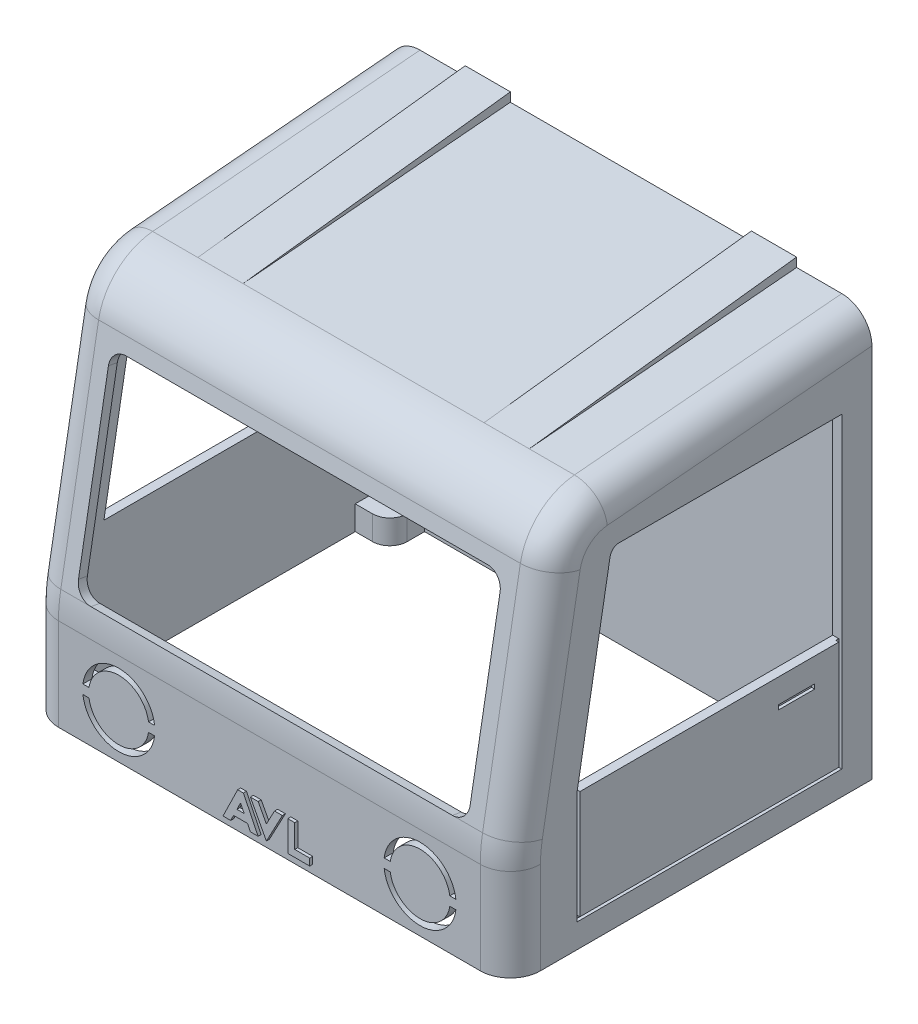
from build123d import *

# Parameters (mm, degrees)
SKETCH1_W            = 160
SKETCH1_H            = 120.00000000000001
BOSS_EXTRUDE1_DEPTH  = 95
MOVE_FACE1_OUTLINE_W = 160
MOVE_FACE1_OUTLINE_H = 99
MOVE_FACE1_DEPTH     = 17
MOVE_START           = -1
MOVE_FACE3_DEPTH     = 162
MOVE_FACE3_2_DEPTH   = 160
BOSS_EXTRUDE2_DEPTH  = 160
FILLET2_R            = 20
FILLET3_R            = 10
FILLET4_R            = 50
SHELL2_T             = -3
CUT_EXTRUDE1_DEPTH   = 10
FILLET5_R            = 5
CUT_EXTRUDE2_REACH   = 225.468
FILLET6_R            = 3
BOSS_EXTRUDE3_START  = -35
SKETCH7_R            = 5.7500000000000036
SKETCH7_R_2          = 2.7499999999999987
SKETCH7_R_3          = 2.7500000000000355
SKETCH7_R_4          = 5.750000000000003
SKETCH7_R_5          = 2.7500000000000346
SKETCH7_R_6          = 5.749999999999999
SKETCH7_R_7          = 2.7499999999999982
BOSS_EXTRUDE3_DEPTH  = 8
CUT_EXTRUDE3_START   = -35
SKETCH7_3_R          = 2.7499999999999982
SKETCH7_3_R_2        = 2.7500000000000355
SKETCH7_3_R_3        = 2.7499999999999987
SKETCH7_3_R_4        = 2.7500000000000346
CUT_EXTRUDE3_DEPTH   = 4
BOSS_EXTRUDE11_START = -35
SKETCH7_4_R          = 2.7499999999999987
SKETCH7_4_R_2        = 2.7500000000000346
SKETCH7_4_R_3        = 2.7499999999999982
SKETCH7_4_R_4        = 2.7500000000000355
BOSS_EXTRUDE11_DEPTH = 1
BOSS_EXTRUDE4_DEPTH  = 1
CUT_EXTRUDE4_DEPTH   = 11
SKETCH11_W           = 11.999999999999986
SKETCH11_H           = 1.5000000000000004
CUT_EXTRUDE5_DEPTH   = 1
CUT_EXTRUDE6_START   = 160
SKETCH11_2_W         = 11.999999999999986
SKETCH11_2_H         = 1.5000000000000004
CUT_EXTRUDE6_DEPTH   = 1
BOSS_EXTRUDE5_DEPTH  = 1
BOSS_EXTRUDE6_START  = 40
BOSS_EXTRUDE6_DEPTH  = 15
BOSS_EXTRUDE7_START  = -40
BOSS_EXTRUDE7_DEPTH  = 15


with BuildPart() as part:
    # Sketch1 → Boss-Extrude1 (new body)
    with BuildSketch(Plane(origin=(0, 0, 0), x_dir=(1, 0, 0), z_dir=(0, 1, 0))):
        with Locations((80, 60.00000000000001)):
            Rectangle(SKETCH1_W, SKETCH1_H)
    extrude(amount=BOSS_EXTRUDE1_DEPTH)

    # Move Face1: read off the stored shape, not the designer's step
    # Move Face1 outline → Move Face1 (cut)
    with BuildSketch(Plane(origin=(0, 0, 0), x_dir=(1, 0, 0), z_dir=(0, 0.173648177666931, 0.984807753012208))):
        with Locations((80, 48.5)):
            Rectangle(MOVE_FACE1_OUTLINE_W, MOVE_FACE1_OUTLINE_H)
    extrude(amount=MOVE_FACE1_DEPTH, mode=Mode.SUBTRACT)

    # Move Face3: read off the stored shape, not the designer's step
    # Move Face3 outline → Move Face3 (cut)
    with BuildSketch(Plane.YZ.offset(MOVE_START)):
        Polygon((95, -16.751063167), (90.588385135, -15.973176438), (95, -66.398165086), align=None)
    extrude(amount=MOVE_FACE3_DEPTH, mode=Mode.SUBTRACT)

    # Move Face3 2 outline → Move Face3 2 (add)
    with BuildSketch(Plane.YZ):
        Polygon((99.689552899, -120), (95, -66.398165086), (95, -120), align=None)
    extrude(amount=MOVE_FACE3_2_DEPTH)

    # Sketch3 → Boss-Extrude2 (add)
    with BuildSketch(Plane(origin=(0, 0, 0), x_dir=(0, 0, -1), z_dir=(1, 0, 0))):
        Polygon((0, 0), (120, 0), (120, -35), (4.29e-15, -35), align=None)
    extrude(amount=BOSS_EXTRUDE2_DEPTH)

    # Fillet2
    fillet2_edges = [part.edges().sort_by_distance(p)[0] for p in [
        (80, 90.588385135, -15.973176438),
    ]]
    fillet(fillet2_edges, radius=FILLET2_R)

    # Fillet3
    fillet3_edges = [part.edges().sort_by_distance(p)[0] for p in [
        (0, -17.5, -2.14e-15),
        (160, -17.5, -2.14e-15),
        (160, 95.80773855265602, -75.63065899035101),
        (160, 37.737496898914046, -6.654138887680599),
        (160, 86.74757698070837, -19.49262868331006),
        (0, 37.73749689891403, -6.654138887680596),
        (0, 86.74757698070837, -19.49262868331006),
        (-5e-17, 95.80773855265602, -75.63065899035101),
    ]]
    fillet(fillet3_edges, radius=FILLET3_R)

    # Fillet4
    # the kernel refuses this fillet: 50 mm, written as the material it takes off along each edge
    with BuildSketch(Plane(origin=(160, -4.374433176296216, -50), x_dir=(0, 0.173648177666931, 0.984807753012208), z_dir=(0, 0.984807753012208, -0.173648177666931))) as fillet4_piece_1:
        with BuildLine():
            CenterArc((40, -10), 10, 0, 90)
            Line((50, -10), (50, 0))
            Line((50, 0), (40, 0))
        make_face()
    revolve(axis=Axis((160, -4.374433176296216, -50), (1, 0, 0)), revolution_arc=10.000000000000012, mode=Mode.SUBTRACT)
    with BuildSketch(Plane(origin=(0, -4.374433176296216, -50), x_dir=(0, -1.2e-16, 1), z_dir=(0, -1, -1.2e-16))) as fillet4_piece_2:
        with BuildLine():
            CenterArc((40, -10), 10, 0, 90)
            Line((50, -10), (50, 0))
            Line((50, 0), (40, 0))
        make_face()
    revolve(axis=Axis((0, -4.374433176296216, -50), (-1, 0, 0)), revolution_arc=10.000000000000012, mode=Mode.SUBTRACT)
    with BuildSketch(Plane(origin=(0, 0, 0), x_dir=(0, -1, 0), z_dir=(1, 0, 0))) as fillet4_piece_3:
        with BuildLine():
            CenterArc((FILLET4_R * 0.0874886635259, FILLET4_R), FILLET4_R, 260, 10)
            Line((-FILLET4_R * 0.086159514141, FILLET4_R * 0.0151922469878), (0, 0))
            Line((0, 0), (FILLET4_R * 0.0874886635259, 0))
        make_face()
    extrude(amount=160, mode=Mode.SUBTRACT)

    # Shell2
    shell2_openings = [part.faces().sort_by_distance(p)[0] for p in [
        (80, -35, -60.129422216),
    ]]
    offset(amount=SHELL2_T, openings=shell2_openings, kind=Kind.INTERSECTION)

    # Sketch5 → Cut-Extrude1 (cut)
    with BuildSketch(Plane(origin=(0, 0, 0), x_dir=(1, 0, 0), z_dir=(0, 0.17364817766693072, 0.9848077530122081))):
        Polygon((15, 71.63931723425382), (145, 71.63931723425382), (145, 4.374433176296183), (15.000000000000007, 4.374433176296183), align=None)
    extrude(amount=-CUT_EXTRUDE1_DEPTH, mode=Mode.SUBTRACT)

    # Fillet5
    fillet5_edges = [part.edges().sort_by_distance(p)[0] for p in [
        (145, 4.047503440549922, -2.236823978907805),
        (15.000000000000007, 4.047503440549922, -2.236823978907805),
        (15, 70.29048276629386, -13.917248516549643),
        (145, 70.29048276629386, -13.917248516549643),
    ]]
    fillet(fillet5_edges, radius=FILLET5_R)

    # Cut-Extrude2: up to this face of the body (flat: up to its plane)
    cut_extrude2_end = Plane(part.part.faces().sort_by_distance((160, 23.574756994, -68.144280622))[0])
    # Sketch6 → Cut-Extrude2 (cut, up to the picked face)
    with BuildSketch(Plane(origin=(0, 0, 0), x_dir=(0, 0, -1), z_dir=(1, 0, 0)), mode=Mode.PRIVATE) as cut_extrude2_sk1:
        Polygon((110, 74.99999999999999), (33.533055790849794, 74.99999999999997), (22.071802044799554, 9.999999999999977), (110, 9.999999999999988), align=None)
    cut_extrude2_tool1 = split(extrude(cut_extrude2_sk1.sketch, amount=CUT_EXTRUDE2_REACH, mode=Mode.PRIVATE), bisect_by=cut_extrude2_end, keep=Keep.BOTH, mode=Mode.PRIVATE)
    add(cut_extrude2_tool1.solids().sort_by(Axis((0, 41.744725, -68.834627), (1, 0, 0)))[0], mode=Mode.SUBTRACT)

    # Fillet6
    fillet6_edges = [part.edges().sort_by_distance(p)[0] for p in [
        (1.5, 74.99999999999997, -33.533055790849794),
        (158.5, 74.99999999999997, -33.533055790849794),
    ]]
    fillet(fillet6_edges, radius=FILLET6_R)

    # Sketch7 → Boss-Extrude3 (add)
    # profile 1 of 18: a face of its own
    with BuildSketch(Plane(origin=(0, 0, 0), x_dir=(1, 0, 0), z_dir=(0, 1, 0)).offset(BOSS_EXTRUDE3_START)):
        with Locations((8.75, 111.24999999999999)):
            Circle(SKETCH7_R)
        with Locations((8.75, 111.24999999999999)):
            Circle(SKETCH7_R_2, mode=Mode.SUBTRACT)
    # profile 2 of 18: a face of its own
    with BuildSketch(Plane(origin=(0, 0, 0), x_dir=(1, 0, 0), z_dir=(0, 1, 0)).offset(BOSS_EXTRUDE3_START)):
        with BuildLine():
            Line((14.500000000000005, 117), (8.750000000000798, 117))
            ThreePointArc((8.750000000000798, 116.99999999999999), (12.815863991822933, 115.31586399182235), (14.500000000000004, 111.24999999999999))
            Line((14.500000000000004, 111.24999999999999), (14.500000000000005, 117))
        make_face()
    # profile 3 of 18: a face of its own
    with BuildSketch(Plane(origin=(0, 0, 0), x_dir=(1, 0, 0), z_dir=(0, 1, 0)).offset(BOSS_EXTRUDE3_START)):
        with BuildLine():
            ThreePointArc((8.749999999999998, 105.49999999999999), (4.684136008177348, 107.18413600817733), (2.9999999999999964, 111.24999999999999))
            Line((3, 111.25000000000082), (3, 105.49999999999999))
            Line((3, 105.49999999999999), (8.75, 105.49999999999999))
        make_face()
    # profile 4 of 18: a face of its own
    with BuildSketch(Plane(origin=(0, 0, 0), x_dir=(1, 0, 0), z_dir=(0, 1, 0)).offset(BOSS_EXTRUDE3_START)):
        with BuildLine():
            Line((8.750000000000798, 117), (3, 117))
            Line((3, 117), (3, 111.25000000000082))
            ThreePointArc((2.9999999999999964, 111.24999999999999), (4.6841360081776315, 115.31586399182292), (8.750000000000798, 116.99999999999999))
        make_face()
    # profile 5 of 18: a face of its own
    with BuildSketch(Plane(origin=(0, 0, 0), x_dir=(1, 0, 0), z_dir=(0, 1, 0)).offset(BOSS_EXTRUDE3_START)):
        with BuildLine():
            Line((157, 117), (151.25000000000003, 117))
            ThreePointArc((151.25000000000003, 116.99999999999999), (155.31586399182268, 115.31586399182264), (157.00000000000003, 111.24999999999999))
            Line((157, 111.24999999999999), (157, 117))
        make_face()
    # profile 6 of 18: a face of its own
    with BuildSketch(Plane(origin=(0, 0, 0), x_dir=(1, 0, 0), z_dir=(0, 1, 0)).offset(BOSS_EXTRUDE3_START)):
        with BuildLine():
            ThreePointArc((157.00000000000003, 111.24999999999999), (155.31586399182268, 107.18413600817733), (151.25000000000003, 105.49999999999999))
            Line((151.25000000000003, 105.49999999999999), (157, 105.49999999999999))
            Line((157, 105.49999999999999), (157, 111.24999999999999))
        make_face()
    # profile 7 of 18: a face of its own
    with BuildSketch(Plane(origin=(0, 0, 0), x_dir=(1, 0, 0), z_dir=(0, 1, 0)).offset(BOSS_EXTRUDE3_START)):
        with Locations((151.25000000000003, 111.24999999999999)):
            Circle(SKETCH7_R)
        with Locations((151.25000000000003, 111.24999999999999)):
            Circle(SKETCH7_R_3, mode=Mode.SUBTRACT)
    # profile 8 of 18: a face of its own
    with BuildSketch(Plane(origin=(0, 0, 0), x_dir=(1, 0, 0), z_dir=(0, 1, 0)).offset(BOSS_EXTRUDE3_START)):
        with BuildLine():
            Line((151.25000000000003, 117), (145.50000000000003, 117))
            Line((145.50000000000003, 117), (145.50000000000003, 111.24999999999999))
            ThreePointArc((145.50000000000003, 111.24999999999999), (147.18413600817738, 115.31586399182264), (151.25000000000003, 116.99999999999999))
        make_face()
    # profile 9 of 18: a face of its own
    with BuildSketch(Plane(origin=(0, 0, 0), x_dir=(1, 0, 0), z_dir=(0, 1, 0)).offset(BOSS_EXTRUDE3_START)):
        with Locations((151.25000000000003, 8.750000000000004)):
            Circle(SKETCH7_R_4)
        with Locations((151.25000000000003, 8.750000000000004)):
            Circle(SKETCH7_R_5, mode=Mode.SUBTRACT)
    # profile 10 of 18: a face of its own
    with BuildSketch(Plane(origin=(0, 0, 0), x_dir=(1, 0, 0), z_dir=(0, 1, 0)).offset(BOSS_EXTRUDE3_START)):
        with BuildLine():
            Line((145.50000000000003, 8.750000000000604), (145.50000000000003, 0.6521265083365915))
            Line((145.50000000000003, 0.6521265083365914), (153.14531379735033, 3.3213458749360854))
            ThreePointArc((153.14531379735033, 3.3213458749360747), (147.9210027286557, 4.061687172619332), (145.50000000000003, 8.750000000000004))
        make_face()
    # profile 11 of 18: a face of its own
    with BuildSketch(Plane(origin=(0, 0, 0), x_dir=(1, 0, 0), z_dir=(0, 1, 0)).offset(BOSS_EXTRUDE3_START)):
        with BuildLine():
            ThreePointArc((157.00000000000003, 8.750000000000002), (156.91708854483653, 7.777062476320838), (156.67074524348422, 6.832183271205649))
            Line((156.6707452434842, 6.83218327120566), (159.38355806446802, 14.500000000000004))
            Line((159.38355806446802, 14.500000000000004), (151.24999999999974, 14.500000000000004))
            ThreePointArc((151.24999999999974, 14.500000000000007), (155.31586399182257, 12.815863991822754), (157.00000000000003, 8.750000000000004))
        make_face()
    # profile 12 of 18: a face of its own
    with BuildSketch(Plane(origin=(0, 0, 0), x_dir=(1, 0, 0), z_dir=(0, 1, 0)).offset(BOSS_EXTRUDE3_START)):
        with Locations((8.75, 8.750000000000004)):
            Circle(SKETCH7_R_6)
        with Locations((8.75, 8.750000000000004)):
            Circle(SKETCH7_R_7, mode=Mode.SUBTRACT)
    # profile 13 of 18: a face of its own
    with BuildSketch(Plane(origin=(0, 0, 0), x_dir=(1, 0, 0), z_dir=(0, 1, 0)).offset(BOSS_EXTRUDE3_START)):
        with BuildLine():
            Line((8.749999999999922, 14.500000000000004), (0.6164419355319968, 14.500000000000004))
            Line((0.6164419355319968, 14.500000000000004), (3.329254756515806, 6.83218327120566))
            ThreePointArc((3.3292547565158026, 6.832183271205659), (4.0547925396971065, 12.069266018974083), (8.749999999999922, 14.500000000000004))
        make_face()
    # profile 14 of 18: a face of its own
    with BuildSketch(Plane(origin=(0, 0, 0), x_dir=(1, 0, 0), z_dir=(0, 1, 0)).offset(BOSS_EXTRUDE3_START)):
        with BuildLine():
            Line((14.500000000000002, 0.6521265083365915), (14.500000000000002, 8.750000000000004))
            ThreePointArc((14.5, 8.750000000000002), (12.078997271344301, 4.061687172619328), (6.854686202649679, 3.3213458749360854))
            Line((6.854686202649678, 3.3213458749360854), (14.500000000000002, 0.6521265083365914))
        make_face()
    # profile 15 of 18: a face of its own
    with BuildSketch(Plane(origin=(0, 0, 0), x_dir=(1, 0, 0), z_dir=(0, 1, 0)).offset(BOSS_EXTRUDE3_START)):
        with Locations((8.75, 8.750000000000004)):
            Circle(SKETCH7_R_7)
    # profile 16 of 18: a face of its own
    with BuildSketch(Plane(origin=(0, 0, 0), x_dir=(1, 0, 0), z_dir=(0, 1, 0)).offset(BOSS_EXTRUDE3_START)):
        with Locations((151.25000000000003, 8.750000000000004)):
            Circle(SKETCH7_R_5)
    # profile 17 of 18: a face of its own
    with BuildSketch(Plane(origin=(0, 0, 0), x_dir=(1, 0, 0), z_dir=(0, 1, 0)).offset(BOSS_EXTRUDE3_START)):
        with Locations((151.25000000000003, 111.24999999999999)):
            Circle(SKETCH7_R_3)
    # profile 18 of 18: a face of its own
    with BuildSketch(Plane(origin=(0, 0, 0), x_dir=(1, 0, 0), z_dir=(0, 1, 0)).offset(BOSS_EXTRUDE3_START)):
        with Locations((8.75, 111.24999999999999)):
            Circle(SKETCH7_R_2)
    extrude(amount=BOSS_EXTRUDE3_DEPTH)

    # Sketch7<3> → Cut-Extrude3 (cut)
    with BuildSketch(Plane(origin=(0, 0, 0), x_dir=(1, 0, 0), z_dir=(0, 1, 0)).offset(CUT_EXTRUDE3_START)):
        with Locations(Location((8.75, 8.750000000000004, 0), (0, 0, 270))):
            Circle(SKETCH7_3_R)
        with Locations(Location((151.25000000000003, 111.24999999999999, 0), (0, 0, 270))):
            Circle(SKETCH7_3_R_2)
        with Locations(Location((8.75, 111.24999999999999, 0), (0, 0, 270))):
            Circle(SKETCH7_3_R_3)
        with Locations(Location((151.25000000000003, 8.750000000000004, 0), (0, 0, 270))):
            Circle(SKETCH7_3_R_4)
    extrude(amount=CUT_EXTRUDE3_DEPTH, mode=Mode.SUBTRACT)

    # Sketch7<4> → Boss-Extrude11 (add)
    with BuildSketch(Plane(origin=(0, 0, 0), x_dir=(1, 0, 0), z_dir=(0, 1, 0)).offset(BOSS_EXTRUDE11_START)):
        with Locations(Location((8.75, 111.24999999999999, 0), (0, 0, 270))):
            Circle(SKETCH7_4_R)
        with Locations(Location((151.25000000000003, 8.750000000000004, 0), (0, 0, 270))):
            Circle(SKETCH7_4_R_2)
        with Locations(Location((8.75, 8.750000000000004, 0), (0, 0, 270))):
            Circle(SKETCH7_4_R_3)
        with Locations(Location((151.25000000000003, 111.24999999999999, 0), (0, 0, 270))):
            Circle(SKETCH7_4_R_4)
    extrude(amount=BOSS_EXTRUDE11_DEPTH)

    # Sketch9 → Boss-Extrude4 (add)
    # profile 1 of 3: a face of its own
    with BuildSketch(Plane.XY):
        Polygon((70.48397184173402, -22.189433176296234), (65.60664595607544, -32.189433176296234), (68.16563041916841, -32.189433176296234), (69.11034492945173, -30.252481386666624), (73.75653259566755, -30.252481386666616), (74.70124710595088, -32.189433176296234), (77.26023156904382, -32.189433176296234), (72.38290568338523, -22.189433176296234), align=None)
        Polygon((70.23212988315318, -27.952481386666616), (71.43343876255963, -25.489433176296235), (72.63474764196607, -27.952481386666616), align=None, mode=Mode.SUBTRACT)
    # profile 2 of 3: a face of its own
    with BuildSketch(Plane.XY):
        Polygon((77.28781679997002, -22.18943317629623), (74.68290568338523, -22.18943317629623), (80, -32.189433176296234), (85.31709431661477, -22.189433176296234), (82.71218320002998, -22.18943317629623), (80, -27.290307899460355), align=None)
    # profile 3 of 3: a face of its own
    with BuildSketch(Plane.XY):
        Polygon((87.11709431661475, -22.189433176296234), (87.11709431661475, -32.189433176296234), (94.39335404392456, -32.18943317629623), (94.39335404392456, -29.88943317629623), (89.41709431661475, -29.88943317629623), (89.41709431661475, -22.189433176296234), align=None)
    extrude(amount=BOSS_EXTRUDE4_DEPTH)

    # Sketch10 → Cut-Extrude4 (cut)
    with BuildSketch(Plane.XY):
        with BuildLine():
            ThreePointArc((20.113140033357478, -18.499999999999666), (30.000000000000032, -10.00000000000001), (39.886859966642554, -18.499999999999705))
            Line((39.88685996664251, -18.500000000000004), (41.90588089979067, -18.500000000000004))
            ThreePointArc((41.90588089979067, -18.500000000000004), (30.00000000000001, -8.000000000000007), (18.09411910020936, -18.500000000000007))
            Line((18.09411910020936, -18.500000000000004), (20.113140033357528, -18.500000000000004))
        make_face()
        with BuildLine():
            Line((41.90588089979067, -21.500000000000004), (39.88685996664251, -21.500000000000004))
            ThreePointArc((39.886859966642554, -21.500000000000306), (30.00000000000003, -29.999999999999996), (20.113140033357478, -21.500000000000338))
            Line((20.113140033357528, -21.500000000000004), (18.09411910020936, -21.500000000000004))
            ThreePointArc((18.09411910020936, -21.500000000000004), (30.00000000000001, -32), (41.90588089979067, -21.499999999999996))
        make_face()
        with BuildLine():
            Line((139.88685996664248, -18.500000000000004), (141.90588089979065, -18.500000000000004))
            ThreePointArc((141.90588089979065, -18.500000000000004), (130, -8.000000000000028), (118.09411910020937, -18.500000000000004))
            Line((118.09411910020937, -18.500000000000004), (120.11314003335752, -18.500000000000004))
            ThreePointArc((120.11314003335748, -18.499999999999662), (130.00000000000003, -10.000000000000025), (139.88685996664253, -18.499999999999705))
        make_face()
        with BuildLine():
            ThreePointArc((118.09411910020937, -21.5), (130, -31.99999999999998), (141.90588089979065, -21.500000000000004))
            Line((141.90588089979065, -21.500000000000004), (139.88685996664248, -21.500000000000004))
            ThreePointArc((139.88685996664253, -21.500000000000306), (130.00000000000003, -29.999999999999982), (120.11314003335748, -21.50000000000034))
            Line((120.11314003335752, -21.500000000000004), (118.09411910020937, -21.500000000000004))
        make_face()
    extrude(amount=-CUT_EXTRUDE4_DEPTH, mode=Mode.SUBTRACT)

    # Sketch11 → Cut-Extrude5 (cut)
    with BuildSketch(Plane(origin=(0, 0, 0), x_dir=(0, 0, -1), z_dir=(1, 0, 0))):
        Polygon((22.071802044799558, -27.000000000000004), (110.00000000000001, -27.000000000000004), (110, 9.999999999999995), (109, 9.999999999999995), (109.00000000000001, -26.000000000000004), (23.071802044799558, -26.000000000000004), (23.071802044799554, 9.999999999999977), (22.071802044799554, 9.999999999999977), align=None)
        with Locations((95, 1.249999999999995)):
            Rectangle(SKETCH11_W, SKETCH11_H)
    extrude(amount=CUT_EXTRUDE5_DEPTH, mode=Mode.SUBTRACT)

    # Sketch11<2> → Cut-Extrude6 (cut)
    with BuildSketch(Plane(origin=(0, 0, 0), x_dir=(0, 0, -1), z_dir=(1, 0, 0)).offset(CUT_EXTRUDE6_START)):
        Polygon((22.071802044799558, -27.000000000000004), (110.00000000000001, -27.000000000000004), (110, 9.999999999999995), (109, 9.999999999999995), (109.00000000000001, -26.000000000000004), (23.071802044799558, -26.000000000000004), (23.071802044799554, 9.999999999999977), (22.071802044799554, 9.999999999999977), align=None)
        with Locations((95, 1.249999999999995)):
            Rectangle(SKETCH11_2_W, SKETCH11_2_H)
    extrude(amount=-CUT_EXTRUDE6_DEPTH, mode=Mode.SUBTRACT)

    # Sketch12 → Boss-Extrude5 (add)
    with BuildSketch(Plane(origin=(0, 0, -120), x_dir=(-1, 0, 0), z_dir=(0, 0, -1))):
        with BuildLine():
            ThreePointArc((-149.99999999999991, 89.6895528992758), (-152.26503010302343, 82.37871971146693), (-148.6971085489457, 75.60756183031265))
            ThreePointArc((-148.6971085489457, 75.60756183031265), (-141.38627530727396, 73.34253168254922), (-134.61511738137975, 76.91045329048985))
            Line((-134.61511738137978, 76.91045329048968), (-150, 89.68955289927585))
        make_face()
        with BuildLine():
            Line((-150, 89.68955289927585), (-134.61511738137978, 76.91045329048968))
            ThreePointArc((-134.61511738137975, 76.91045329048985), (-132.90212374346123, 79.90327033332368), (-132.30755869068994, 83.30000309488278))
            ThreePointArc((-132.30755869068994, 83.30000309488278), (-133.2550589789604, 87.54879692009207), (-135.9180084845173, 90.99244407046383))
            ThreePointArc((-135.9180084845173, 90.99244407046383), (-143.2288418489255, 93.25747452805044), (-149.99999999999991, 89.6895528992758))
        make_face()
        with BuildLine():
            Line((-134.61511738137978, 76.91045329048968), (-103.34299620931965, 50.93498364653418))
            ThreePointArc((-103.3429962093197, 50.93498364653419), (-96.57183827532042, 54.50290525522467), (-89.26100502923096, 52.237875096309544))
            Line((-89.26100502923096, 52.23787509630961), (-135.91800848451726, 90.99244407046392))
            ThreePointArc((-135.9180084845173, 90.99244407046383), (-133.2550589789604, 87.54879692009207), (-132.30755869068994, 83.30000309488278))
            ThreePointArc((-132.30755869068994, 83.30000309488278), (-132.90212374346123, 79.90327033332368), (-134.61511738137975, 76.91045329048985))
        make_face()
        with BuildLine():
            Line((-148.69710854894572, 75.60756183031259), (-102.04010489115782, 36.85299268795495))
            ThreePointArc((-102.04010489115782, 36.852992687954995), (-105.60802632030114, 43.62415054473648), (-103.3429962093197, 50.93498364653419))
            Line((-103.34299620931965, 50.93498364653418), (-134.61511738137978, 76.91045329048968))
            ThreePointArc((-134.61511738137975, 76.91045329048985), (-141.38627530727396, 73.34253168254922), (-148.6971085489457, 75.60756183031265))
        make_face()
        with BuildLine():
            ThreePointArc((-89.2610050828201, 36.8529925434602), (-88.57948708226273, 37.47436603615718), (-87.95811359069948, 38.15588403774822))
            Line((-87.95811359069954, 38.15588403774808), (-103.34299620931965, 50.93498364653418))
            ThreePointArc((-103.3429962093197, 50.93498364653419), (-105.60802632030114, 43.62415054473648), (-102.04010489115782, 36.852992687954995))
            ThreePointArc((-102.04010489115782, 36.852992687954995), (-95.6505550130808, 34.54543384214122), (-89.2610050828201, 36.8529925434602))
        make_face()
        with BuildLine():
            Line((-103.34299620931965, 50.93498364653418), (-87.95811359069954, 38.15588403774808))
            ThreePointArc((-87.95811359069948, 38.15588403774822), (-86.24511995278097, 41.14870108058205), (-85.65055490000967, 44.54543384214117))
            ThreePointArc((-85.65055490000967, 44.54543384214117), (-86.59805528090482, 48.79422786469703), (-89.26100502923096, 52.237875096309544))
            ThreePointArc((-89.26100502923096, 52.237875096309544), (-96.57183827532042, 54.50290525522467), (-103.3429962093197, 50.93498364653419))
        make_face()
        with BuildLine():
            ThreePointArc((-103.34299620931972, 12.15633565537156), (-96.57183831261828, 8.588414050131941), (-89.26100508685836, 10.853444157729324))
            ThreePointArc((-89.26100508685836, 10.853444157729324), (-86.59805529681958, 14.297091403300623), (-85.65055490000965, 18.54588545976458))
            ThreePointArc((-85.65055490000965, 18.545885459764584), (-86.24511995278097, 21.94261822132374), (-87.95811359069953, 24.935435264157604))
            Line((-87.95811359069955, 24.93543526415765), (-103.34299620931968, 12.156335655371517))
        make_face()
        with BuildLine():
            ThreePointArc((-102.04010499867034, 26.23832652464796), (-105.60802632673925, 19.467168687584554), (-103.34299620931972, 12.15633565537156))
            Line((-103.34299620931968, 12.156335655371517), (-87.95811359069955, 24.93543526415765))
            ThreePointArc((-87.95811359069953, 24.935435264157604), (-88.57948709222559, 25.61695327571145), (-89.26100510449675, 26.23832677645077))
            ThreePointArc((-89.26100510449675, 26.23832677645077), (-95.6505550970523, 28.54588545976455), (-102.04010499867034, 26.23832652464796))
        make_face()
        with BuildLine():
            Line((-133.12339285238266, -12.580067249013794), (-103.34299620931968, 12.156335655371524))
            ThreePointArc((-103.34299620931972, 12.15633565537156), (-105.60802632673925, 19.467168687584554), (-102.04010499867034, 26.23832652464796))
            Line((-102.04010499867036, 26.238326524647988), (-147.2053837190476, -11.277175538900151))
            ThreePointArc((-147.2053837190476, -11.277175538900142), (-139.89455058352632, -9.012145659091914), (-133.12339285238255, -12.580067249013947))
        make_face()
        with BuildLine():
            Line((-134.4262847999322, -26.6620587303795), (-89.26100508685835, 10.853444157729314))
            ThreePointArc((-89.26100508685836, 10.853444157729324), (-96.57183831261828, 8.588414050131941), (-103.34299620931972, 12.15633565537156))
            Line((-103.34299620931968, 12.156335655371524), (-133.12339285238266, -12.580067249013794))
            ThreePointArc((-133.12339285238255, -12.580067249013947), (-131.41039921446406, -15.57288429184778), (-130.81583416169278, -18.96961705340689))
            ThreePointArc((-130.81583416169278, -18.969617053406893), (-131.76333468316184, -23.218411375470176), (-134.4262847999322, -26.662058730379503))
        make_face()
        with BuildLine():
            ThreePointArc((-148.50827547100286, -25.359166857799984), (-141.73711786645248, -28.92708843600922), (-134.4262847999322, -26.662058730379503))
            ThreePointArc((-134.4262847999322, -26.662058730379503), (-131.76333468316184, -23.218411375470176), (-130.81583416169278, -18.969617053406893))
            ThreePointArc((-130.81583416169278, -18.96961705340689), (-131.41039921446406, -15.57288429184778), (-133.12339285238255, -12.580067249013947))
            Line((-133.12339285238266, -12.580067249013794), (-148.50827547100286, -25.35916685779998))
        make_face()
        with BuildLine():
            ThreePointArc((-147.2053837190476, -11.277175538900142), (-150.77330555600776, -18.048333475240547), (-148.50827547100286, -25.359166857799984))
            Line((-148.50827547100286, -25.35916685779998), (-133.12339285238266, -12.580067249013794))
            ThreePointArc((-133.12339285238255, -12.580067249013947), (-139.89455058352632, -9.012145659091914), (-147.2053837190476, -11.277175538900142))
        make_face()
        with BuildLine():
            ThreePointArc((-70.73899476947597, 10.853444038396779), (-63.4281615943977, 8.588414058734982), (-56.65700379068013, 12.156335655371642))
            Line((-56.65700379068019, 12.156335655371524), (-72.04188640930035, 24.93543526415765))
            ThreePointArc((-72.04188640930039, 24.93543526415764), (-74.30691650101993, 17.624601954172054), (-70.73899476947597, 10.853444038396779))
        make_face()
        with BuildLine():
            Line((-72.04188640930035, 24.93543526415765), (-56.65700379068019, 12.156335655371524))
            ThreePointArc((-56.65700379068013, 12.156335655371642), (-54.94401015276162, 15.14915269820548), (-54.34944509999033, 18.545885459764587))
            ThreePointArc((-54.34944509999033, 18.54588545976459), (-55.29694546063917, 22.794679439183597), (-57.95989515589977, 26.238326653038172))
            ThreePointArc((-57.95989515589977, 26.238326653038172), (-64.34944497431704, 28.54588545976457), (-70.73899485073399, 26.238326813637293))
            ThreePointArc((-70.73899485073399, 26.238326813637293), (-71.4205128871979, 25.61695329628791), (-72.04188640930039, 24.93543526415764))
        make_face()
        with BuildLine():
            Line((-56.65700379068019, 12.156335655371524), (-26.87660714761723, -12.580067249013743))
            ThreePointArc((-26.876607147617428, -12.58006724901397), (-20.105449248302012, -9.012145643532307), (-12.794616021117193, -11.277175754726148))
            Line((-12.794616021117193, -11.277175754726146), (-57.95989515589975, 26.23832665303821))
            ThreePointArc((-57.95989515589977, 26.238326653038172), (-55.29694546063917, 22.794679439183597), (-54.34944509999033, 18.54588545976459))
            ThreePointArc((-54.34944509999033, 18.545885459764587), (-54.94401015276162, 15.14915269820548), (-56.65700379068013, 12.156335655371642))
        make_face()
        with BuildLine():
            ThreePointArc((-25.573715763009382, -26.66205826278486), (-29.14163725461974, -19.890900393817105), (-26.876607147617428, -12.58006724901397))
            Line((-26.87660714761723, -12.580067249013743), (-56.65700379068019, 12.156335655371524))
            ThreePointArc((-56.65700379068013, 12.156335655371642), (-63.4281615943977, 8.588414058734982), (-70.73899476947597, 10.853444038396779))
            Line((-70.73899476947597, 10.85344403839678), (-25.573715763009375, -26.66205826278487))
        make_face()
        with BuildLine():
            ThreePointArc((-25.573715763009382, -26.66205826278486), (-18.26288249789701, -28.92708846971943), (-11.491724528997054, -25.3591668577999))
            Line((-11.49172452899705, -25.359166857799895), (-26.87660714761723, -12.580067249013743))
            ThreePointArc((-26.876607147617428, -12.58006724901397), (-29.14163725461974, -19.890900393817105), (-25.573715763009382, -26.66205826278486))
        make_face()
        with BuildLine():
            Line((-26.87660714761723, -12.580067249013743), (-11.49172452899705, -25.359166857799895))
            ThreePointArc((-11.491724528997054, -25.3591668577999), (-9.77873089107847, -22.366349814966018), (-9.184165838307141, -18.969617053406818))
            ThreePointArc((-9.184165838307141, -18.969617053406814), (-10.131666234001724, -14.7208229993192), (-12.794616021117195, -11.277175754726146))
            ThreePointArc((-12.794616021117193, -11.277175754726148), (-20.105449248302012, -9.012145643532307), (-26.876607147617428, -12.58006724901397))
        make_face()
        with BuildLine():
            ThreePointArc((-72.04188640930036, 38.15588403774815), (-71.42051293831365, 37.47436605673366), (-70.73899496194916, 36.852992580646855))
            ThreePointArc((-70.73899496194916, 36.852992580646855), (-64.34944512909007, 34.54543384214122), (-57.95989528280108, 36.85299254345994))
            ThreePointArc((-57.95989528280108, 36.85299254345994), (-55.296945495685094, 40.296639788053156), (-54.34944509999031, 44.545433842141186))
            ThreePointArc((-54.34944509999031, 44.545433842141186), (-54.944010152761614, 47.94216660370031), (-56.65700379068013, 50.93498364653414))
            Line((-56.65700379068021, 50.93498364653426), (-72.04188640930033, 38.15588403774814))
        make_face()
        with BuildLine():
            ThreePointArc((-70.73899482535371, 52.23787521709539), (-74.30691650436597, 45.46671731156826), (-72.04188640930036, 38.15588403774815))
            Line((-72.04188640930033, 38.15588403774814), (-56.65700379068021, 50.93498364653426))
            ThreePointArc((-56.65700379068013, 50.93498364653414), (-63.42816163056315, 54.50290524651688), (-70.73899482535371, 52.23787521709539))
        make_face()
        with BuildLine():
            ThreePointArc((-70.73899482535371, 52.23787521709539), (-63.42816163056315, 54.50290524651688), (-56.65700379068013, 50.93498364653414))
            Line((-56.65700379068021, 50.93498364653426), (-25.384882618620182, 76.9104532904897))
            ThreePointArc((-25.38488261862027, 76.91045329048977), (-27.64991267107836, 84.22128702482264), (-24.081990323154116, 90.99244506084429))
            Line((-24.081990323154116, 90.9924450608443), (-70.73899482535373, 52.23787521709542))
        make_face()
        with BuildLine():
            ThreePointArc((-54.34944509999031, 44.545433842141186), (-55.296945495685094, 40.296639788053156), (-57.95989528280108, 36.85299254345994))
            Line((-57.95989528280107, 36.85299254345994), (-11.302892131536481, 75.60756126508565))
            ThreePointArc((-11.302892131536481, 75.60756126508565), (-18.613725133150712, 73.34253172329804), (-25.38488261862027, 76.91045329048977))
            Line((-25.384882618620182, 76.9104532904897), (-56.65700379068021, 50.93498364653426))
            ThreePointArc((-56.65700379068013, 50.93498364653414), (-54.944010152761614, 47.94216660370031), (-54.34944509999031, 44.545433842141186))
        make_face()
        with BuildLine():
            ThreePointArc((-25.38488261862027, 76.91045329048977), (-18.613725133150712, 73.34253172329804), (-11.302892131536481, 75.60756126508565))
            ThreePointArc((-11.302892131536481, 75.60756126508565), (-8.639941881590241, 79.05120866456117), (-7.6924413093100785, 83.3000030948828))
            ThreePointArc((-7.6924413093100785, 83.3000030948828), (-8.287006362081403, 86.69673585644199), (-9.999999999999982, 89.68955289927588))
            Line((-10, 89.68955289927588), (-25.384882618620182, 76.9104532904897))
        make_face()
        with BuildLine():
            ThreePointArc((-24.081990323154116, 90.99244506084429), (-27.64991267107836, 84.22128702482264), (-25.38488261862027, 76.91045329048977))
            Line((-25.384882618620182, 76.9104532904897), (-10, 89.68955289927588))
            ThreePointArc((-9.999999999999982, 89.68955289927588), (-16.771157379370294, 93.25747445665107), (-24.081990323154116, 90.99244506084429))
        make_face()
    extrude(amount=BOSS_EXTRUDE5_DEPTH)


with BuildPart() as body_2:
    # Sketch13 → Boss-Extrude6 (new body)
    with BuildSketch(Plane(origin=(80, 0, 0), x_dir=(0, 0, -1), z_dir=(1, 0, 0)).offset(BOSS_EXTRUDE6_START)):
        Polygon((31.260350171381532, 91.93698631698892), (120, 102.68955289927587), (120, 99.68955289927587), align=None)
    extrude(amount=BOSS_EXTRUDE6_DEPTH)


with BuildPart() as body_3:
    # Sketch13<2> → Boss-Extrude7 (new body)
    with BuildSketch(Plane(origin=(80, 0, 0), x_dir=(0, 0, -1), z_dir=(1, 0, 0)).offset(BOSS_EXTRUDE7_START)):
        Polygon((31.260350171381532, 91.93698631698892), (120, 102.68955289927587), (120, 99.68955289927587), align=None)
    extrude(amount=-BOSS_EXTRUDE7_DEPTH)


solid = Compound([part.part, body_2.part, body_3.part])
